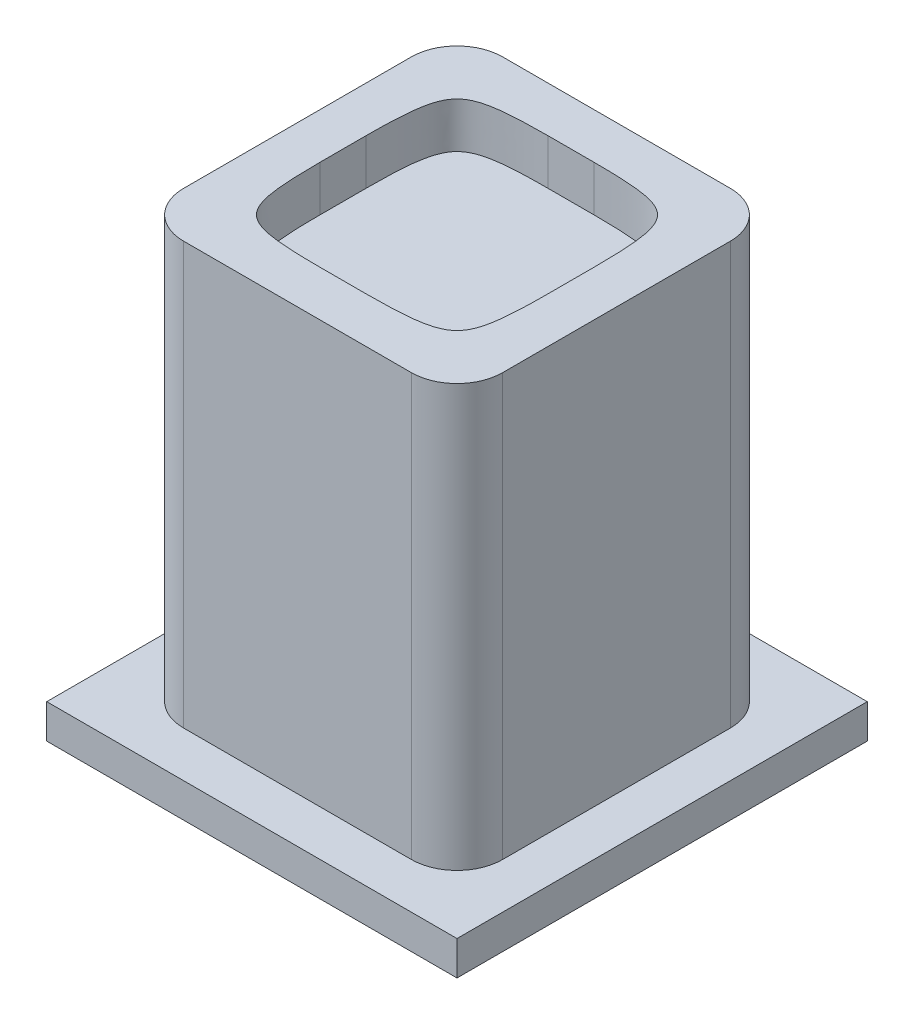
from build123d import *

# Parameters (mm, degrees)
SKETCH1_W           = 7
SKETCH1_H           = 7
SKETCH1_R           = 1.8
BOSS_EXTRUDE1_DEPTH = 10
SKETCH1_4_R         = 1.8
CUT_EXTRUDE1_DEPTH  = 0.75
SKETCH2_W           = 8
SKETCH2_H           = 0.75
BOSS_EXTRUDE2_DEPTH = 1
CIRPATTERN1_DEPTH   = 0.75
SKETCH4_W           = 5
SKETCH4_H           = 5
CUT_EXTRUDE2_DEPTH  = 1
FILLET1_SIZE        = 2
FILLET2_R           = 1


with BuildPart() as part:
    # Sketch1 → Boss-Extrude1 (new body)
    # profile 1 of 2: a face of its own
    with BuildSketch(Plane(origin=(0, 0, 0), x_dir=(1, 0, 0), z_dir=(0, 1, 0))):
        with Locations((-10.213000206, 16.666176773)):
            Rectangle(SKETCH1_W, SKETCH1_H)
        with Locations((-10.213000206, 16.666176773)):
            Circle(SKETCH1_R, mode=Mode.SUBTRACT)
    # profile 2 of 2: a face of its own
    with BuildSketch(Plane(origin=(0, 0, 0), x_dir=(1, 0, 0), z_dir=(0, 1, 0))):
        with Locations((-10.213000206, 16.666176773)):
            Circle(SKETCH1_R)
    extrude(amount=BOSS_EXTRUDE1_DEPTH)

    # Sketch1<4> → Cut-Extrude1 (cut)
    with BuildSketch(Plane(origin=(0, 0, 0), x_dir=(1, 0, 0), z_dir=(0, 1, 0))):
        with Locations(Location((-10.213000206, 16.666176773, 0), (0, 0, 270))):
            Circle(SKETCH1_4_R)
    extrude(amount=CUT_EXTRUDE1_DEPTH, mode=Mode.SUBTRACT)

    # Sketch2 → Boss-Extrude2 (add)
    with BuildSketch(Plane(origin=(-6.713000206, 0, 0), x_dir=(0, 0, -1), z_dir=(1, 0, 0))):
        with Locations((17.166176773, 0.375)):
            Rectangle(SKETCH2_W, SKETCH2_H)
    extrude(amount=BOSS_EXTRUDE2_DEPTH)

    # CirPattern1: read off the stored shape, not the designer's step
    # CirPattern1 outline → CirPattern1 (add)
    with BuildSketch(Plane(origin=(0, 0, 0), x_dir=(1, 0, 0), z_dir=(0, 1, 0))):
        Polygon((-6.713000206, 21.166176773), (-14.713000206, 21.166176773), (-14.713000206, 12.166176773), (-5.713000206, 12.166176773), (-5.713000206, 13.166176773), (-13.713000206, 13.166176773), (-13.713000206, 20.166176773), (-6.713000206, 20.166176773), align=None)
    extrude(amount=CIRPATTERN1_DEPTH)

    # Sketch4 → Cut-Extrude2 (cut)
    with BuildSketch(Plane(origin=(0, 10, 0), x_dir=(1, 0, 0), z_dir=(0, 1, 0))):
        with Locations((-10.213000206, 16.666176773)):
            Rectangle(SKETCH4_W, SKETCH4_H)
    extrude(amount=-CUT_EXTRUDE2_DEPTH, mode=Mode.SUBTRACT)

    # Fillet1
    # a fillet whose section is not a circle: 2 mm, written as the material it adds along each edge
    with BuildSketch(Plane(origin=(-12.713000206, 10, -19.166176773), x_dir=(0, 0, 1), z_dir=(0, -1, 0)), Plane(origin=(-7.713000206, 10, -19.166176773), x_dir=(-1, 0, 0), z_dir=(0, -1, 0)), Plane(origin=(-12.713000206, 10, -14.166176773), x_dir=(1, 0, 0), z_dir=(0, -1, 0))) as fillet1_piece_1:
        with BuildLine():
            Bezier((FILLET1_SIZE, 0), (0, 0), (0, -FILLET1_SIZE), weights=[1, 2.333333333, 1])
            Line((0, -FILLET1_SIZE), (0, 0))
            Line((0, 0), (FILLET1_SIZE, 0))
        make_face()
    extrude(amount=6)
    with BuildSketch(Plane(origin=(-7.713000206, 10, -14.166176773), x_dir=(-1, 0, 0), z_dir=(0, -1, 0))) as fillet1_piece_2:
        with BuildLine():
            Bezier((FILLET1_SIZE, 0), (0, 0), (0, FILLET1_SIZE), weights=[1, 2.333333333, 1])
            Line((0, FILLET1_SIZE), (0, 0))
            Line((0, 0), (FILLET1_SIZE, 0))
        make_face()
    extrude(amount=6)

    # Fillet2
    fillet2_edges = [part.edges().sort_by_distance(p)[0] for p in [
        (-6.713000206, 5.375, -13.166176773),
        (-13.713000206, 5.375, -13.166176773),
        (-13.713000206, 5.375, -20.166176773),
        (-6.713000206, 5.375, -20.166176773),
    ]]
    fillet(fillet2_edges, radius=FILLET2_R)


solid = part.part
